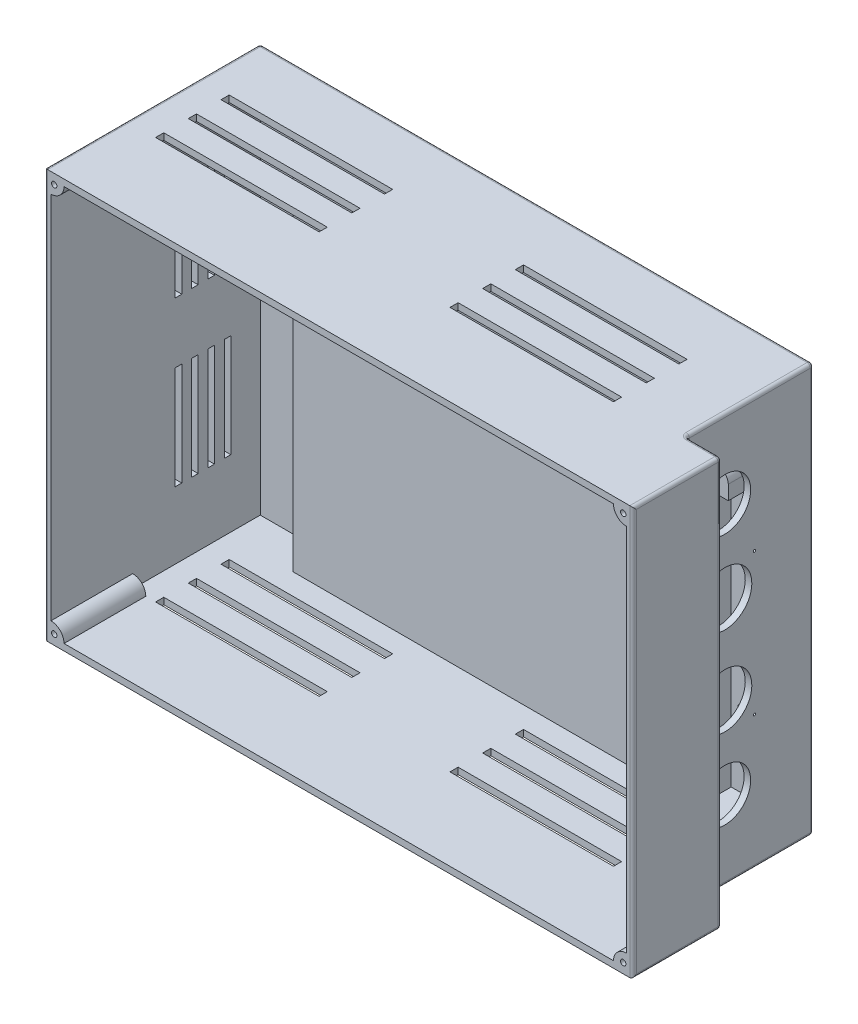
from build123d import *

# Parameters (mm, degrees)
SKETCH_2_W                      = 180
SKETCH_2_H                      = 125
EXTRUDE_1_DEPTH                 = 66
SKETCH_3_W                      = 120
SKETCH_3_H                      = 119
CUT_EXTRUDE_1_DEPTH             = 10
SKETCH_4_W                      = 39
SKETCH_4_H                      = 125
CUT_EXTRUDE_2_DEPTH             = 10.8
SHELL_START                     = 12
SHELL_1_OUTLINE_W               = 165.2
SHELL_1_OUTLINE_H               = 121
SHELL_1_DEPTH                   = 54
SHELL_START_2                   = 2
SHELL_1_2_OUTLINE_W             = 21.2
SHELL_1_2_OUTLINE_H             = 121
SHELL_1_2_OUTLINE_W_2           = 20
SHELL_1_2_DEPTH                 = 10
SHELL_START_3                   = 41
SHELL_1_3_OUTLINE_W             = 10.8
SHELL_1_3_OUTLINE_H             = 121
SHELL_1_3_DEPTH                 = 25
EXTRUDE_START                   = -3
SKETCH_6_W                      = 4
SKETCH_6_H                      = 4
EXTRUDE_2_DEPTH                 = 1
CUT_EXTRUDE_3_REACH             = 194.07
SKETCH_7_R                      = 8.25
SKETCH_7_R_2                    = 0.375
SKETCH_7_R_3                    = 7.9
CUT_EXTRUDE_4_REACH             = 169.574
SKETCH_8_W                      = 50
SKETCH_8_H                      = 2.5
CUT_EXTRUDE_4_DIRECTION_2_DEPTH = 168.573864311
SKETCH_9_R                      = 0.825
EXTRUDE_3_DEPTH                 = 25
SKETCH_10_W                     = 6.700985522
SKETCH_10_H                     = 9.924307849
SKETCH_10_R                     = 0.825
SKETCH_10_W_2                   = 6.512984506
SKETCH_10_H_2                   = 7.372999746
EXTRUDE_4_DEPTH                 = 7.3999492
CUT_EXTRUDE_5_REACH             = 129.915
SKETCH_11_R                     = 6.1
SKETCH_11_R_2                   = 2.6
FILLET_1_R                      = 3
FILLET_2_R                      = 1
CUT_EXTRUDE_6_REACH             = 203.649
SKETCH_12_W                     = 2
SKETCH_12_H                     = 31.5


# Read off the part's stored shape, not the designer's step: 抽壳1
with BuildPart() as part:
    # 草图2 → 凸台-拉伸1 (new body)
    with BuildSketch(Plane.XY):
        Rectangle(SKETCH_2_W, SKETCH_2_H)
    extrude(amount=EXTRUDE_1_DEPTH)

    # 草图3 → 切除-拉伸1 (cut)
    with BuildSketch(Plane(origin=(0, 0, 0), x_dir=(-1, 0, 0), z_dir=(0, 0, -1))):
        with Locations((6, 0)):
            Rectangle(SKETCH_3_W, SKETCH_3_H)
    extrude(amount=-CUT_EXTRUDE_1_DEPTH, mode=Mode.SUBTRACT)

    # 草图4 → 切除-拉伸2 (cut)
    with BuildSketch(Plane(origin=(90, 0, 0), x_dir=(0, 0, -1), z_dir=(1, 0, 0))):
        with Locations((-19.5, 0)):
            Rectangle(SKETCH_4_W, SKETCH_4_H)
    extrude(amount=-CUT_EXTRUDE_2_DEPTH, mode=Mode.SUBTRACT)

    # 抽壳1 outline → 抽壳1 (cut)
    with BuildSketch(Plane.XY.offset(SHELL_START)):
        with Locations((-5.4, 0)):
            Rectangle(SHELL_1_OUTLINE_W, SHELL_1_OUTLINE_H)
    extrude(amount=SHELL_1_DEPTH, mode=Mode.SUBTRACT)

    # Shell 1 2 outline → Shell 1 2 (cut)
    with BuildSketch(Plane.XY.offset(SHELL_START_2)):
        with Locations((66.6, 0)):
            Rectangle(SHELL_1_2_OUTLINE_W, SHELL_1_2_OUTLINE_H)
        with Locations((-78, 0)):
            Rectangle(SHELL_1_2_OUTLINE_W_2, SHELL_1_2_OUTLINE_H)
    extrude(amount=SHELL_1_2_DEPTH, mode=Mode.SUBTRACT)

    # Shell 1 3 outline → Shell 1 3 (cut)
    with BuildSketch(Plane.XY.offset(SHELL_START_3)):
        with Locations((82.6, 0)):
            Rectangle(SHELL_1_3_OUTLINE_W, SHELL_1_3_OUTLINE_H)
    extrude(amount=SHELL_1_3_DEPTH, mode=Mode.SUBTRACT)

    # 草图6 → 凸台-拉伸2 (add)
    with BuildSketch(Plane(origin=(79.2, 0, 0), x_dir=(0, 0, -1), z_dir=(1, 0, 0)).offset(EXTRUDE_START)):
        with Locations((-18.064716044, -21.665100098)):
            Rectangle(SKETCH_6_W, SKETCH_6_H)
        with Locations((-36.221233073, -21.665100098)):
            Rectangle(SKETCH_6_W, SKETCH_6_H)
        with Locations((-36.221233073, 21.665100098)):
            Rectangle(SKETCH_6_W, SKETCH_6_H)
        with Locations((-18.064716044, 21.665100098)):
            Rectangle(SKETCH_6_W, SKETCH_6_H)
    extrude(amount=EXTRUDE_2_DEPTH)

    # 草图7 → 切除-拉伸3 (cut, up to next)
    with BuildSketch(Plane(origin=(79.2, 0, 0), x_dir=(0, 0, -1), z_dir=(1, 0, 0)), mode=Mode.PRIVATE) as cut_extrude_3_sk1:
        with Locations(Location((-27.142974559, -13.5, 0), (0, 0, 90))):
            Circle(SKETCH_7_R)
    cut_extrude_3_tool1 = extrude(cut_extrude_3_sk1.sketch, amount=-CUT_EXTRUDE_3_REACH, mode=Mode.PRIVATE) & part.part
    # 草图7 → 切除-拉伸3 (cut, up to next)
    with BuildSketch(Plane(origin=(79.2, 0, 0), x_dir=(0, 0, -1), z_dir=(1, 0, 0)), mode=Mode.PRIVATE) as cut_extrude_3_sk2:
        with Locations(Location((-27.142974559, 13.5, 0), (0, 0, 90))):
            Circle(SKETCH_7_R)
    cut_extrude_3_tool2 = extrude(cut_extrude_3_sk2.sketch, amount=-CUT_EXTRUDE_3_REACH, mode=Mode.PRIVATE) & part.part
    # 草图7 → 切除-拉伸3 (cut, up to next)
    with BuildSketch(Plane(origin=(79.2, 0, 0), x_dir=(0, 0, -1), z_dir=(1, 0, 0)), mode=Mode.PRIVATE) as cut_extrude_3_sk3:
        with Locations(Location((-18.064716044, -21.665100098, 0), (0, 0, 90))):
            Circle(SKETCH_7_R_2)
    cut_extrude_3_tool3 = extrude(cut_extrude_3_sk3.sketch, amount=-CUT_EXTRUDE_3_REACH, mode=Mode.PRIVATE) & part.part
    # 草图7 → 切除-拉伸3 (cut, up to next)
    with BuildSketch(Plane(origin=(79.2, 0, 0), x_dir=(0, 0, -1), z_dir=(1, 0, 0)), mode=Mode.PRIVATE) as cut_extrude_3_sk4:
        with Locations(Location((-18.064716044, 21.665100098, 0), (0, 0, 90))):
            Circle(SKETCH_7_R_2)
    cut_extrude_3_tool4 = extrude(cut_extrude_3_sk4.sketch, amount=-CUT_EXTRUDE_3_REACH, mode=Mode.PRIVATE) & part.part
    # 草图7 → 切除-拉伸3 (cut, up to next)
    with BuildSketch(Plane(origin=(79.2, 0, 0), x_dir=(0, 0, -1), z_dir=(1, 0, 0)), mode=Mode.PRIVATE) as cut_extrude_3_sk5:
        with Locations(Location((-36.221233073, 21.665100098, 0), (0, 0, 90))):
            Circle(SKETCH_7_R_2)
    cut_extrude_3_tool5 = extrude(cut_extrude_3_sk5.sketch, amount=-CUT_EXTRUDE_3_REACH, mode=Mode.PRIVATE) & part.part
    # 草图7 → 切除-拉伸3 (cut, up to next)
    with BuildSketch(Plane(origin=(79.2, 0, 0), x_dir=(0, 0, -1), z_dir=(1, 0, 0)), mode=Mode.PRIVATE) as cut_extrude_3_sk6:
        with Locations(Location((-36.221233073, -21.665100098, 0), (0, 0, 90))):
            Circle(SKETCH_7_R_2)
    cut_extrude_3_tool6 = extrude(cut_extrude_3_sk6.sketch, amount=-CUT_EXTRUDE_3_REACH, mode=Mode.PRIVATE) & part.part
    # 草图7 → 切除-拉伸3 (cut, up to next)
    with BuildSketch(Plane(origin=(79.2, 0, 0), x_dir=(0, 0, -1), z_dir=(1, 0, 0)), mode=Mode.PRIVATE) as cut_extrude_3_sk7:
        with Locations(Location((-27.142974559, 38.5, 0), (0, 0, 90))):
            Circle(SKETCH_7_R_3)
    cut_extrude_3_tool7 = extrude(cut_extrude_3_sk7.sketch, amount=-CUT_EXTRUDE_3_REACH, mode=Mode.PRIVATE) & part.part
    # 草图7 → 切除-拉伸3 (cut, up to next)
    with BuildSketch(Plane(origin=(79.2, 0, 0), x_dir=(0, 0, -1), z_dir=(1, 0, 0)), mode=Mode.PRIVATE) as cut_extrude_3_sk8:
        with Locations(Location((-27.142974559, -38.5, 0), (0, 0, 90))):
            Circle(SKETCH_7_R_3)
    cut_extrude_3_tool8 = extrude(cut_extrude_3_sk8.sketch, amount=-CUT_EXTRUDE_3_REACH, mode=Mode.PRIVATE) & part.part
    add(cut_extrude_3_tool1.solids().sort_by_distance((79.2, -13.5, 27.142975))[0], mode=Mode.SUBTRACT)
    add(cut_extrude_3_tool2.solids().sort_by_distance((79.2, 13.5, 27.142975))[0], mode=Mode.SUBTRACT)
    add(cut_extrude_3_tool3.solids().sort_by_distance((79.2, -21.6651, 18.064716))[0], mode=Mode.SUBTRACT)
    add(cut_extrude_3_tool4.solids().sort_by_distance((79.2, 21.6651, 18.064716))[0], mode=Mode.SUBTRACT)
    add(cut_extrude_3_tool5.solids().sort_by_distance((79.2, 21.6651, 36.221233))[0], mode=Mode.SUBTRACT)
    add(cut_extrude_3_tool6.solids().sort_by_distance((79.2, -21.6651, 36.221233))[0], mode=Mode.SUBTRACT)
    add(cut_extrude_3_tool7.solids().sort_by_distance((79.2, 38.5, 27.142975))[0], mode=Mode.SUBTRACT)
    add(cut_extrude_3_tool8.solids().sort_by_distance((79.2, -38.5, 27.142975))[0], mode=Mode.SUBTRACT)

    # 切除-拉伸4: up to this face of the body (flat: up to its plane)
    cut_extrude_4_end = Plane(part.part.faces().sort_by_distance((-3.109707823, 62.5, 33.496229972))[0])
    # 草图8 → 切除-拉伸4 (cut, up to the picked face)
    with BuildSketch(Plane.XZ.offset(62.5), mode=Mode.PRIVATE) as cut_extrude_4_sk1:
        with Locations((-56, 39.75)):
            Rectangle(SKETCH_8_W, SKETCH_8_H)
    cut_extrude_4_tool1 = split(extrude(cut_extrude_4_sk1.sketch, amount=-CUT_EXTRUDE_4_REACH, mode=Mode.PRIVATE), bisect_by=cut_extrude_4_end, keep=Keep.BOTH, mode=Mode.PRIVATE)
    # 草图8 → 切除-拉伸4 (cut, up to the picked face)
    with BuildSketch(Plane.XZ.offset(62.5), mode=Mode.PRIVATE) as cut_extrude_4_sk2:
        with Locations((34, 39.75)):
            Rectangle(SKETCH_8_W, SKETCH_8_H)
    cut_extrude_4_tool2 = split(extrude(cut_extrude_4_sk2.sketch, amount=-CUT_EXTRUDE_4_REACH, mode=Mode.PRIVATE), bisect_by=cut_extrude_4_end, keep=Keep.BOTH, mode=Mode.PRIVATE)
    # 草图8 → 切除-拉伸4 (cut, up to the picked face)
    with BuildSketch(Plane.XZ.offset(62.5), mode=Mode.PRIVATE) as cut_extrude_4_sk3:
        with Locations((34, 29.75)):
            Rectangle(SKETCH_8_W, SKETCH_8_H)
    cut_extrude_4_tool3 = split(extrude(cut_extrude_4_sk3.sketch, amount=-CUT_EXTRUDE_4_REACH, mode=Mode.PRIVATE), bisect_by=cut_extrude_4_end, keep=Keep.BOTH, mode=Mode.PRIVATE)
    # 草图8 → 切除-拉伸4 (cut, up to the picked face)
    with BuildSketch(Plane.XZ.offset(62.5), mode=Mode.PRIVATE) as cut_extrude_4_sk4:
        with Locations((34, 19.75)):
            Rectangle(SKETCH_8_W, SKETCH_8_H)
    cut_extrude_4_tool4 = split(extrude(cut_extrude_4_sk4.sketch, amount=-CUT_EXTRUDE_4_REACH, mode=Mode.PRIVATE), bisect_by=cut_extrude_4_end, keep=Keep.BOTH, mode=Mode.PRIVATE)
    # 草图8 → 切除-拉伸4 (cut, up to the picked face)
    with BuildSketch(Plane.XZ.offset(62.5), mode=Mode.PRIVATE) as cut_extrude_4_sk5:
        with Locations((-56, 29.75)):
            Rectangle(SKETCH_8_W, SKETCH_8_H)
    cut_extrude_4_tool5 = split(extrude(cut_extrude_4_sk5.sketch, amount=-CUT_EXTRUDE_4_REACH, mode=Mode.PRIVATE), bisect_by=cut_extrude_4_end, keep=Keep.BOTH, mode=Mode.PRIVATE)
    # 草图8 → 切除-拉伸4 (cut, up to the picked face)
    with BuildSketch(Plane.XZ.offset(62.5), mode=Mode.PRIVATE) as cut_extrude_4_sk6:
        with Locations((-56, 19.75)):
            Rectangle(SKETCH_8_W, SKETCH_8_H)
    cut_extrude_4_tool6 = split(extrude(cut_extrude_4_sk6.sketch, amount=-CUT_EXTRUDE_4_REACH, mode=Mode.PRIVATE), bisect_by=cut_extrude_4_end, keep=Keep.BOTH, mode=Mode.PRIVATE)
    add(cut_extrude_4_tool1.solids().sort_by(Axis((-56, -62.5, 39.75), (0, 1, 0)))[0], mode=Mode.SUBTRACT)
    add(cut_extrude_4_tool2.solids().sort_by(Axis((34, -62.5, 39.75), (0, 1, 0)))[0], mode=Mode.SUBTRACT)
    add(cut_extrude_4_tool3.solids().sort_by(Axis((34, -62.5, 29.75), (0, 1, 0)))[0], mode=Mode.SUBTRACT)
    add(cut_extrude_4_tool4.solids().sort_by(Axis((34, -62.5, 19.75), (0, 1, 0)))[0], mode=Mode.SUBTRACT)
    add(cut_extrude_4_tool5.solids().sort_by(Axis((-56, -62.5, 29.75), (0, 1, 0)))[0], mode=Mode.SUBTRACT)
    add(cut_extrude_4_tool6.solids().sort_by(Axis((-56, -62.5, 19.75), (0, 1, 0)))[0], mode=Mode.SUBTRACT)

    # 草图8 → 切除-拉伸4 direction 2 (cut)
    with BuildSketch(Plane.XZ.offset(62.5)):
        with Locations((-56, 39.75)):
            Rectangle(SKETCH_8_W, SKETCH_8_H)
        with Locations((34, 39.75)):
            Rectangle(SKETCH_8_W, SKETCH_8_H)
        with Locations((34, 29.75)):
            Rectangle(SKETCH_8_W, SKETCH_8_H)
        with Locations((34, 19.75)):
            Rectangle(SKETCH_8_W, SKETCH_8_H)
        with Locations((-56, 29.75)):
            Rectangle(SKETCH_8_W, SKETCH_8_H)
        with Locations((-56, 19.75)):
            Rectangle(SKETCH_8_W, SKETCH_8_H)
    extrude(amount=CUT_EXTRUDE_4_DIRECTION_2_DEPTH, mode=Mode.SUBTRACT)

    # 草图9 → 凸台-拉伸3 (add)
    # profile 1 of 4: a face of its own
    with BuildSketch(Plane.XY.offset(66)):
        with BuildLine():
            Line((-88, 60.5), (-84, 60.5))
            ThreePointArc((-84, 60.5), (-85.171572875, 57.671572875), (-88, 56.5))
            Line((-88, 56.5), (-88, 60.5))
        make_face()
        with Locations((-87, 59.5)):
            Circle(SKETCH_9_R, mode=Mode.SUBTRACT)
    # profile 2 of 4: a face of its own
    with BuildSketch(Plane.XY.offset(66)):
        with BuildLine():
            Line((-88, -60.5), (-88, -56.5))
            ThreePointArc((-88, -56.5), (-85.171572875, -57.671572875), (-84, -60.5))
            Line((-84, -60.5), (-88, -60.5))
        make_face()
        with Locations((-87, -59.5)):
            Circle(SKETCH_9_R, mode=Mode.SUBTRACT)
    # profile 3 of 4: a face of its own
    with BuildSketch(Plane.XY.offset(66)):
        with BuildLine():
            Line((88, -60.5), (84, -60.5))
            ThreePointArc((84, -60.5), (85.171572875, -57.671572875), (88, -56.5))
            Line((88, -56.5), (88, -60.5))
        make_face()
        with Locations((87, -59.5)):
            Circle(SKETCH_9_R, mode=Mode.SUBTRACT)
    # profile 4 of 4: a face of its own
    with BuildSketch(Plane.XY.offset(66)):
        with BuildLine():
            Line((88, 60.5), (88, 56.5))
            ThreePointArc((88, 56.5), (85.171572875, 57.671572875), (84, 60.5))
            Line((84, 60.5), (88, 60.5))
        make_face()
        with Locations((87, 59.5)):
            Circle(SKETCH_9_R, mode=Mode.SUBTRACT)
    extrude(amount=-EXTRUDE_3_DEPTH)

    # 草图10 → 开关螺孔凸台-拉伸4 (add)
    # profile 1 of 4: a face of its own
    with BuildSketch(Plane.XY.offset(2)):
        with Locations((73.849507239, 55.537846076)):
            Rectangle(SKETCH_10_W, SKETCH_10_H)
        with Locations((74.126014732, 54.575692151)):
            Circle(SKETCH_10_R, mode=Mode.SUBTRACT)
    # profile 2 of 4: a face of its own
    with BuildSketch(Plane.XY.offset(2)):
        with Locations((59.256492253, 55.537846076)):
            Rectangle(SKETCH_10_W_2, SKETCH_10_H)
        with Locations((59.13998476, 54.575692151)):
            Circle(SKETCH_10_R, mode=Mode.SUBTRACT)
    # profile 3 of 4: a face of its own
    with BuildSketch(Plane.XY.offset(2)):
        with Locations((59.256492253, 25.941135382)):
            Rectangle(SKETCH_10_W_2, SKETCH_10_H_2)
        with Locations((59.012984506, 26.127635255)):
            Circle(SKETCH_10_R, mode=Mode.SUBTRACT)
    # profile 4 of 4: a face of its own
    with BuildSketch(Plane.XY.offset(2)):
        with Locations((73.849507239, 25.941135382)):
            Rectangle(SKETCH_10_W, SKETCH_10_H_2)
        with Locations((73.999014478, 26.254635509)):
            Circle(SKETCH_10_R, mode=Mode.SUBTRACT)
    extrude(amount=EXTRUDE_4_DEPTH)

    # 草图11 → 切除-拉伸5 (cut, up to next)
    with BuildSketch(Plane(origin=(0, 0, 0), x_dir=(-1, 0, 0), z_dir=(0, 0, -1)), mode=Mode.PRIVATE) as cut_extrude_5_sk1:
        with Locations((-66.76, 36.160655321)):
            Circle(SKETCH_11_R)
    cut_extrude_5_tool1 = extrude(cut_extrude_5_sk1.sketch, amount=-CUT_EXTRUDE_5_REACH, mode=Mode.PRIVATE) & part.part
    # 草图11 → 切除-拉伸5 (cut, up to next)
    with BuildSketch(Plane(origin=(0, 0, 0), x_dir=(-1, 0, 0), z_dir=(0, 0, -1)), mode=Mode.PRIVATE) as cut_extrude_5_sk2:
        with Locations((-65.481981904, 49.241681483)):
            Circle(SKETCH_11_R_2)
    cut_extrude_5_tool2 = extrude(cut_extrude_5_sk2.sketch, amount=-CUT_EXTRUDE_5_REACH, mode=Mode.PRIVATE) & part.part
    add(cut_extrude_5_tool1.solids().sort_by_distance((66.76, 36.160655, 0))[0], mode=Mode.SUBTRACT)
    add(cut_extrude_5_tool2.solids().sort_by_distance((65.481982, 49.241681, 0))[0], mode=Mode.SUBTRACT)

    # 圆角1
    fillet_1_edges = [part.edges().sort_by_distance(p)[0] for p in [
        (70.499014478, 50.575692151, 5.6999746),
        (62.512984506, 50.575692151, 5.6999746),
        (62.512984506, 29.627635255, 5.6999746),
        (70.499014478, 29.627635255, 5.6999746),
    ]]
    fillet(fillet_1_edges, radius=FILLET_1_R)

    # 圆角2
    fillet_2_edges = [part.edges().sort_by_distance(p)[0] for p in [
        (-90, 0, 66),
        (54, 0, 10),
        (-6, 59.5, 10),
        (-66, 0, 10),
        (-6, -59.5, 10),
        (54, 0, 0),
        (-6, -59.5, 0),
        (-66, 0, 0),
        (-6, 59.5, 0),
        (-5.4, 62.5, 0),
        (84.6, -62.5, 39),
        (84.6, 62.5, 39),
        (90, 0, 39),
        (79.2, 0, 0),
        (79.2, -62.5, 19.5),
        (79.2, 0, 39),
        (79.2, 62.5, 19.5),
        (72.86, 36.160655321, 0),
        (68.081981904, 49.241681483, 0),
        (90, 0, 66),
        (-5.4, -62.5, 0),
        (-90, 0, 0),
        (90, -62.5, 52.5),
        (-90, -62.5, 33),
        (-90, 62.5, 33),
        (90, 62.5, 52.5),
    ]]
    fillet(fillet_2_edges, radius=FILLET_2_R)

    # 草图12 → 切除-拉伸6 (cut, up to next)
    with BuildSketch(Plane.ZY.offset(90), mode=Mode.PRIVATE) as cut_extrude_6_sk1:
        with Locations((12, 25.75)):
            Rectangle(SKETCH_12_W, SKETCH_12_H)
    cut_extrude_6_tool1 = extrude(cut_extrude_6_sk1.sketch, amount=-CUT_EXTRUDE_6_REACH, mode=Mode.PRIVATE) & part.part
    # 草图12 → 切除-拉伸6 (cut, up to next)
    with BuildSketch(Plane.ZY.offset(90), mode=Mode.PRIVATE) as cut_extrude_6_sk2:
        with Locations((17, 25.75)):
            Rectangle(SKETCH_12_W, SKETCH_12_H)
    cut_extrude_6_tool2 = extrude(cut_extrude_6_sk2.sketch, amount=-CUT_EXTRUDE_6_REACH, mode=Mode.PRIVATE) & part.part
    # 草图12 → 切除-拉伸6 (cut, up to next)
    with BuildSketch(Plane.ZY.offset(90), mode=Mode.PRIVATE) as cut_extrude_6_sk3:
        with Locations((22, 25.75)):
            Rectangle(SKETCH_12_W, SKETCH_12_H)
    cut_extrude_6_tool3 = extrude(cut_extrude_6_sk3.sketch, amount=-CUT_EXTRUDE_6_REACH, mode=Mode.PRIVATE) & part.part
    # 草图12 → 切除-拉伸6 (cut, up to next)
    with BuildSketch(Plane.ZY.offset(90), mode=Mode.PRIVATE) as cut_extrude_6_sk4:
        with Locations((27, 25.75)):
            Rectangle(SKETCH_12_W, SKETCH_12_H)
    cut_extrude_6_tool4 = extrude(cut_extrude_6_sk4.sketch, amount=-CUT_EXTRUDE_6_REACH, mode=Mode.PRIVATE) & part.part
    # 草图12 → 切除-拉伸6 (cut, up to next)
    with BuildSketch(Plane.ZY.offset(90), mode=Mode.PRIVATE) as cut_extrude_6_sk5:
        with Locations((17, -24.25)):
            Rectangle(SKETCH_12_W, SKETCH_12_H)
    cut_extrude_6_tool5 = extrude(cut_extrude_6_sk5.sketch, amount=-CUT_EXTRUDE_6_REACH, mode=Mode.PRIVATE) & part.part
    # 草图12 → 切除-拉伸6 (cut, up to next)
    with BuildSketch(Plane.ZY.offset(90), mode=Mode.PRIVATE) as cut_extrude_6_sk6:
        with Locations((22, -24.25)):
            Rectangle(SKETCH_12_W, SKETCH_12_H)
    cut_extrude_6_tool6 = extrude(cut_extrude_6_sk6.sketch, amount=-CUT_EXTRUDE_6_REACH, mode=Mode.PRIVATE) & part.part
    # 草图12 → 切除-拉伸6 (cut, up to next)
    with BuildSketch(Plane.ZY.offset(90), mode=Mode.PRIVATE) as cut_extrude_6_sk7:
        with Locations((27, -24.25)):
            Rectangle(SKETCH_12_W, SKETCH_12_H)
    cut_extrude_6_tool7 = extrude(cut_extrude_6_sk7.sketch, amount=-CUT_EXTRUDE_6_REACH, mode=Mode.PRIVATE) & part.part
    # 草图12 → 切除-拉伸6 (cut, up to next)
    with BuildSketch(Plane.ZY.offset(90), mode=Mode.PRIVATE) as cut_extrude_6_sk8:
        with Locations((12, -24.25)):
            Rectangle(SKETCH_12_W, SKETCH_12_H)
    cut_extrude_6_tool8 = extrude(cut_extrude_6_sk8.sketch, amount=-CUT_EXTRUDE_6_REACH, mode=Mode.PRIVATE) & part.part
    add(cut_extrude_6_tool1.solids().sort_by_distance((-90, 25.75, 12))[0], mode=Mode.SUBTRACT)
    add(cut_extrude_6_tool2.solids().sort_by_distance((-90, 25.75, 17))[0], mode=Mode.SUBTRACT)
    add(cut_extrude_6_tool3.solids().sort_by_distance((-90, 25.75, 22))[0], mode=Mode.SUBTRACT)
    add(cut_extrude_6_tool4.solids().sort_by_distance((-90, 25.75, 27))[0], mode=Mode.SUBTRACT)
    add(cut_extrude_6_tool5.solids().sort_by_distance((-90, -24.25, 17))[0], mode=Mode.SUBTRACT)
    add(cut_extrude_6_tool6.solids().sort_by_distance((-90, -24.25, 22))[0], mode=Mode.SUBTRACT)
    add(cut_extrude_6_tool7.solids().sort_by_distance((-90, -24.25, 27))[0], mode=Mode.SUBTRACT)
    add(cut_extrude_6_tool8.solids().sort_by_distance((-90, -24.25, 12))[0], mode=Mode.SUBTRACT)


solid = part.part
